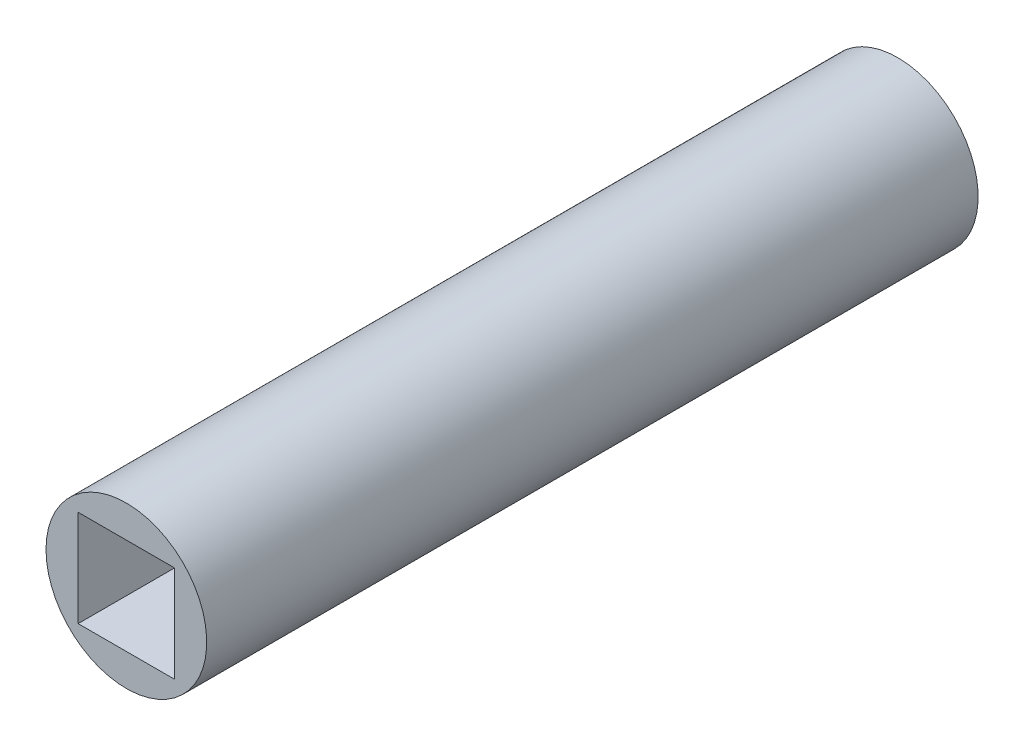
from build123d import *

# Parameters (mm, degrees)
SKETCH1_W          = 15.875
SKETCH1_H          = 152.4
SKETCH2_W          = 19.05
SKETCH2_H          = 19.05
CUT_EXTRUDE1_DEPTH = 155.044770278


with BuildPart() as part:
    # Sketch1 → Revolve1 (revolve)
    with BuildSketch(Plane(origin=(0, 0, 0), x_dir=(1, 0, 0), z_dir=(0, 1, 0))):
        with Locations((-7.9375, -76.2)):
            Rectangle(SKETCH1_W, SKETCH1_H)
    revolve(axis=Axis((0, 0, 0), (0, 0, 1)))

    # Sketch2 → Cut-Extrude1 (cut, through all)
    with BuildSketch(Plane.XY.offset(152.4)):
        Rectangle(SKETCH2_W, SKETCH2_H)
    extrude(amount=-CUT_EXTRUDE1_DEPTH, mode=Mode.SUBTRACT)


solid = part.part
